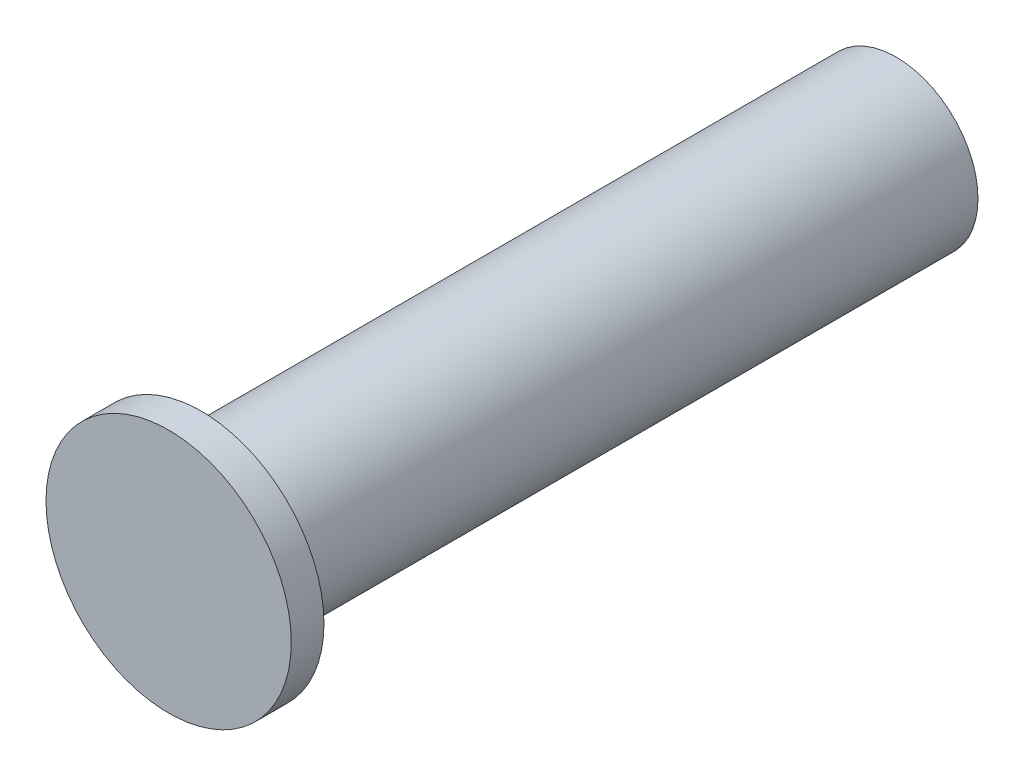
from build123d import *

# Parameters (mm, degrees)
SK_CANA_R    = 2
CANA_DEPTH   = 17
SK_CABEZA_R  = 3
CABEZA_DEPTH = 0.8


with BuildPart() as part:
    # Sk_Cana → Cana (new body)
    with BuildSketch(Plane.XY.offset(51.9)):
        Circle(SK_CANA_R)
    extrude(amount=CANA_DEPTH)

    # Sk_Cabeza → Cabeza (add)
    with BuildSketch(Plane.XY.offset(68.9)):
        Circle(SK_CABEZA_R)
    extrude(amount=CABEZA_DEPTH)


solid = part.part
